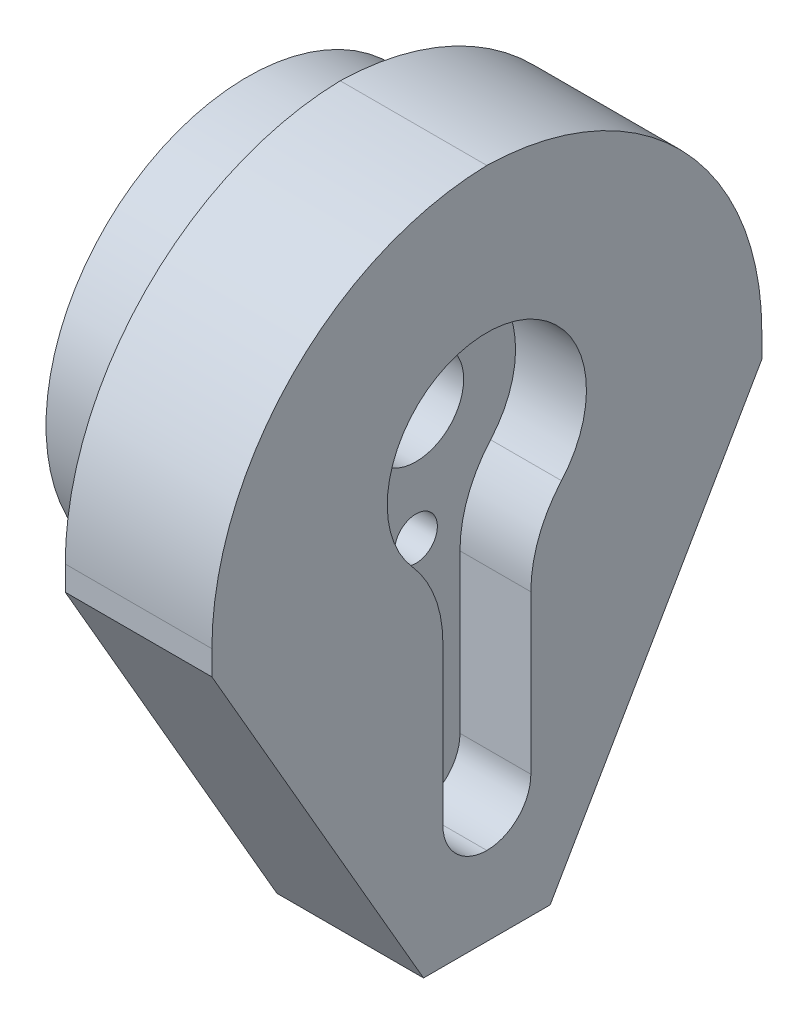
from build123d import *

# Parameters (mm, degrees)
SKETCH1_W           = 20
SKETCH1_H           = 20
BOSS_EXTRUDE1_DEPTH = 20
SKETCH2_W           = 45
SKETCH2_H           = 70
BOSS_EXTRUDE2_DEPTH = 12
CUT_EXTRUDE1_DEPTH  = 5.8
FILLET1_R           = 3.6
FILLET2_R           = 10
SKETCH5_R           = 3.9
CUT_EXTRUDE2_DEPTH  = 53.490475326
CUT_EXTRUDE3_REACH  = 51.17
SKETCH6_R           = 1.75
SKETCH13_W          = 20
SKETCH13_H          = 20
CUT_EXTRUDE9_DEPTH  = 20
SKETCH14_R          = 16.475
BOSS_EXTRUDE3_DEPTH = 7.6
SKETCH15_W          = 12
SKETCH15_H          = 45
CUT_EXTRUDE10_DEPTH = 15
FILLET3_R           = 23
CHAMFER1_SIZE       = 30
CHAMFER1_SIZE2      = 17.320508076
CHAMFER2_SIZE       = 30
CHAMFER2_SIZE2      = 17.320508076
SKETCH16_R          = 13.475
CUT_EXTRUDE11_DEPTH = 7.6
FILLET4_R           = 1


# Some blends are built 0.0001 mm under size
with BuildPart() as part:
    # Sketch1 → Boss-Extrude1 (new body)
    with BuildSketch(Plane(origin=(0, 0, 0), x_dir=(0, 0, -1), z_dir=(1, 0, 0))):
        Rectangle(SKETCH1_W, SKETCH1_H)
    extrude(amount=BOSS_EXTRUDE1_DEPTH)

    # Sketch2 → Boss-Extrude2 (add)
    with BuildSketch(Plane(origin=(20, 0, 0), x_dir=(0, 0, -1), z_dir=(1, 0, 0))):
        Rectangle(SKETCH2_W, SKETCH2_H)
    extrude(amount=BOSS_EXTRUDE2_DEPTH)

    # Sketch4 → Cut-Extrude1 (cut)
    with BuildSketch(Plane(origin=(32, 0, 0), x_dir=(0, 0, -1), z_dir=(1, 0, 0))):
        with BuildLine():
            Line((3.6, -28.55), (-3.6, -28.55))
            Line((-3.6, -28.55), (-3.6, -7.311805523))
            ThreePointArc((-3.6, -7.311805523), (0, 8.15), (3.6, -7.311805523))
            Line((3.6, -7.311805523), (3.6, -28.55))
        make_face()
    extrude(amount=-CUT_EXTRUDE1_DEPTH, mode=Mode.SUBTRACT)

    # Fillet1
    fillet1_edges = [part.edges().sort_by_distance(p)[0] for p in [
        (29.1, -28.55, 3.6),
        (29.1, -28.55, -3.6),
    ]]
    fillet(fillet1_edges, radius=FILLET1_R - 0.0001)  # a hair under: the kernel refuses the full size

    # Fillet2
    fillet2_edges = [part.edges().sort_by_distance(p)[0] for p in [
        (29.1, -7.311805523, 3.6),
        (29.1, -7.311805523, -3.6),
    ]]
    fillet(fillet2_edges, radius=FILLET2_R)

    # Sketch5 → Cut-Extrude2 (cut, through all)
    with BuildSketch(Plane.ZY):
        Circle(SKETCH5_R)
    extrude(amount=-CUT_EXTRUDE2_DEPTH, mode=Mode.SUBTRACT)

    # Sketch6 → Cut-Extrude3 (cut, up to next)
    with BuildSketch(Plane(origin=(26.2, 0, 0), x_dir=(0, 0, -1), z_dir=(1, 0, 0)), mode=Mode.PRIVATE) as cut_extrude3_sk1:
        with Locations((0, -20.6)):
            Circle(SKETCH6_R)
    cut_extrude3_tool1 = extrude(cut_extrude3_sk1.sketch, amount=-CUT_EXTRUDE3_REACH, mode=Mode.PRIVATE) & part.part
    # Sketch6 → Cut-Extrude3 (cut, up to next)
    with BuildSketch(Plane(origin=(26.2, 0, 0), x_dir=(0, 0, -1), z_dir=(1, 0, 0)), mode=Mode.PRIVATE) as cut_extrude3_sk2:
        with Locations((0, -9.35)):
            Circle(SKETCH6_R)
    cut_extrude3_tool2 = extrude(cut_extrude3_sk2.sketch, amount=-CUT_EXTRUDE3_REACH, mode=Mode.PRIVATE) & part.part
    add(cut_extrude3_tool1.solids().sort_by_distance((26.2, -20.6, 0))[0], mode=Mode.SUBTRACT)
    add(cut_extrude3_tool2.solids().sort_by_distance((26.2, -9.35, 0))[0], mode=Mode.SUBTRACT)

    # Sketch13 → Cut-Extrude9 (cut)
    with BuildSketch(Plane.ZY):
        Rectangle(SKETCH13_W, SKETCH13_H)
    extrude(amount=-CUT_EXTRUDE9_DEPTH, mode=Mode.SUBTRACT)

    # Sketch14 → Boss-Extrude3 (add)
    with BuildSketch(Plane.ZY.offset(-20)):
        with Locations(Location((0, 0, 0), (0, 0, 180))):
            Circle(SKETCH14_R)
    extrude(amount=BOSS_EXTRUDE3_DEPTH)

    # Sketch15 → Cut-Extrude10 (cut)
    with BuildSketch(Plane(origin=(0, 35, 0), x_dir=(1, 0, 0), z_dir=(0, 1, 0))):
        with Locations((26, 0)):
            Rectangle(SKETCH15_W, SKETCH15_H)
    extrude(amount=-CUT_EXTRUDE10_DEPTH, mode=Mode.SUBTRACT)

    # Fillet3
    # the kernel refuses this fillet: 23 mm, written as the material it takes off along each edge
    with BuildSketch(Plane(origin=(-37.5, 20, -22.5), x_dir=(0, -1, 0), z_dir=(1, 0, 0)), Plane(origin=(89.5, 20, 22.5), x_dir=(0, -1, 0), z_dir=(-1, 0, 0))) as fillet3_piece_1:
        with BuildLine():
            CenterArc((FILLET3_R, -FILLET3_R), FILLET3_R, 90, 90)
            Line((0, -FILLET3_R), (0, 0))
            Line((0, 0), (FILLET3_R, 0))
        make_face()
    extrude(amount=127, mode=Mode.SUBTRACT)

    # Chamfer1
    chamfer1_edges = [part.edges().sort_by_distance(p)[0] for p in [
        (26, -35, 22.5),
    ]]
    chamfer1_side = [part.faces().sort_by_distance(p)[0] for p in [
        (26, -19, 22.5),
    ]]
    chamfer(chamfer1_edges, length=CHAMFER1_SIZE, length2=CHAMFER1_SIZE2, reference=chamfer1_side[0])

    # Chamfer2
    chamfer2_edges = [part.edges().sort_by_distance(p)[0] for p in [
        (26, -35, -22.5),
    ]]
    chamfer2_side = [part.faces().sort_by_distance(p)[0] for p in [
        (26, -19, -22.5),
    ]]
    chamfer(chamfer2_edges, length=CHAMFER2_SIZE, length2=CHAMFER2_SIZE2, reference=chamfer2_side[0])

    # Sketch16 → Cut-Extrude11 (cut)
    with BuildSketch(Plane.ZY.offset(-12.4)):
        Circle(SKETCH16_R)
    extrude(amount=-CUT_EXTRUDE11_DEPTH, mode=Mode.SUBTRACT)

    # Fillet4
    fillet4_edges = [part.edges().sort_by_distance(p)[0] for p in [
        (20, 0, 16.475),
        (20, 0, -13.475),
    ]]
    fillet(fillet4_edges, radius=FILLET4_R)


solid = part.part
